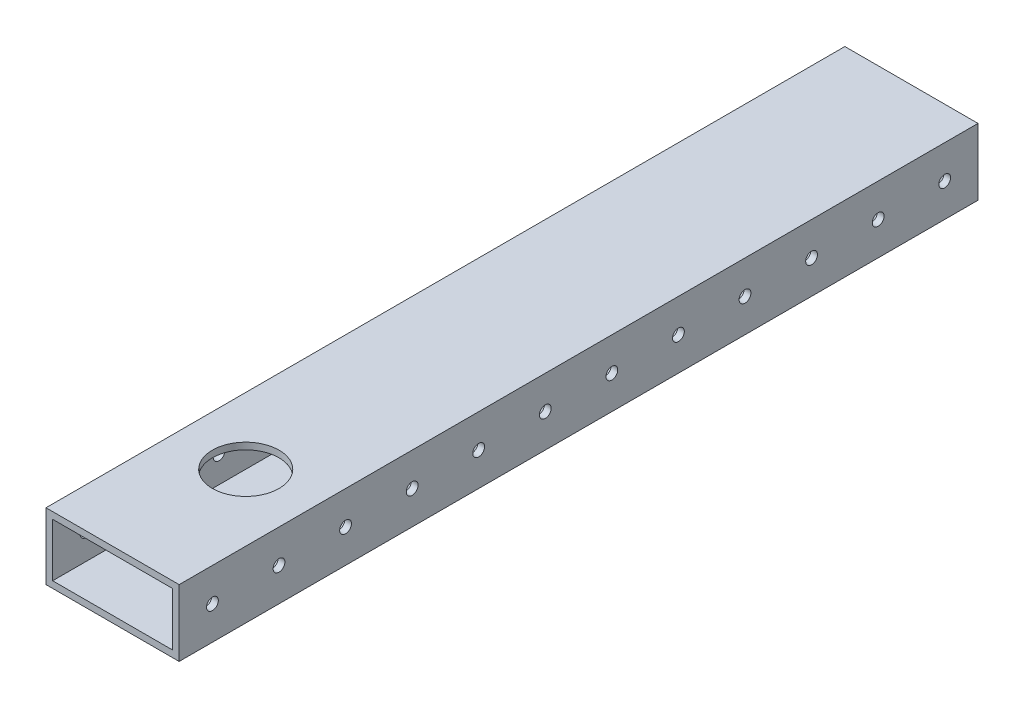
from build123d import *

# Parameters (mm, degrees)
SKETCH1_W               = 50.8
SKETCH1_H               = 25.4
SKETCH1_W_2             = 45.72
SKETCH1_H_2             = 20.32
BOSS_EXTRUDE1_DEPTH     = 355.6
F_8_CLEARANCE_HOLE1_D   = 4.4958
F_1_1_DIAMETER_HOLE1_D  = 25.4
CUT_EXTRUDE1_DEPTH      = 421.64
CUT_EXTRUDE1_DEPTH_BACK = 71.882
SKETCH8_W               = 50.8
SKETCH8_H               = 50.8


with BuildPart() as part:
    # Sketch1 → Boss-Extrude1 (new body)
    with BuildSketch(Plane.XY):
        Rectangle(SKETCH1_W, SKETCH1_H)
        Rectangle(SKETCH1_W_2, SKETCH1_H_2, mode=Mode.SUBTRACT)
    extrude(amount=-BOSS_EXTRUDE1_DEPTH)

    # #8 Clearance Hole1 (through all)
    with Locations(Plane(origin=(25.4, 0, 0), x_dir=(0, 0, -1), z_dir=(1, 0, 0))):
        with Locations((12.7, 0), (38.1, 0), (63.5, 0), (88.9, 0), (114.3, 0), (139.7, 0), (165.1, 0), (190.5, 0), (215.9, 0), (241.3, 0), (266.7, 0), (292.1, 0), (317.5, 0), (342.9, 0)):
            Hole(F_8_CLEARANCE_HOLE1_D / 2)

    # 1 (1) Diameter Hole1 (through all)
    with Locations(Plane(origin=(0, 12.7, 0), x_dir=(1, 0, 0), z_dir=(0, 1, 0))):
        with Locations((0, 101.6)):
            Hole(F_1_1_DIAMETER_HOLE1_D / 2)

    # Sketch8 → Cut-Extrude1 (cut, two sides: drawn at the far end of the back side and taken through both)
    with BuildSketch(Plane(origin=(0, 12.7, 0), x_dir=(1, 0, 0), z_dir=(0, 1, 0)).offset(-CUT_EXTRUDE1_DEPTH_BACK)):
        with Locations((0, 25.4)):
            Rectangle(SKETCH8_W, SKETCH8_H)
    extrude(amount=CUT_EXTRUDE1_DEPTH + CUT_EXTRUDE1_DEPTH_BACK, mode=Mode.SUBTRACT)


solid = part.part
